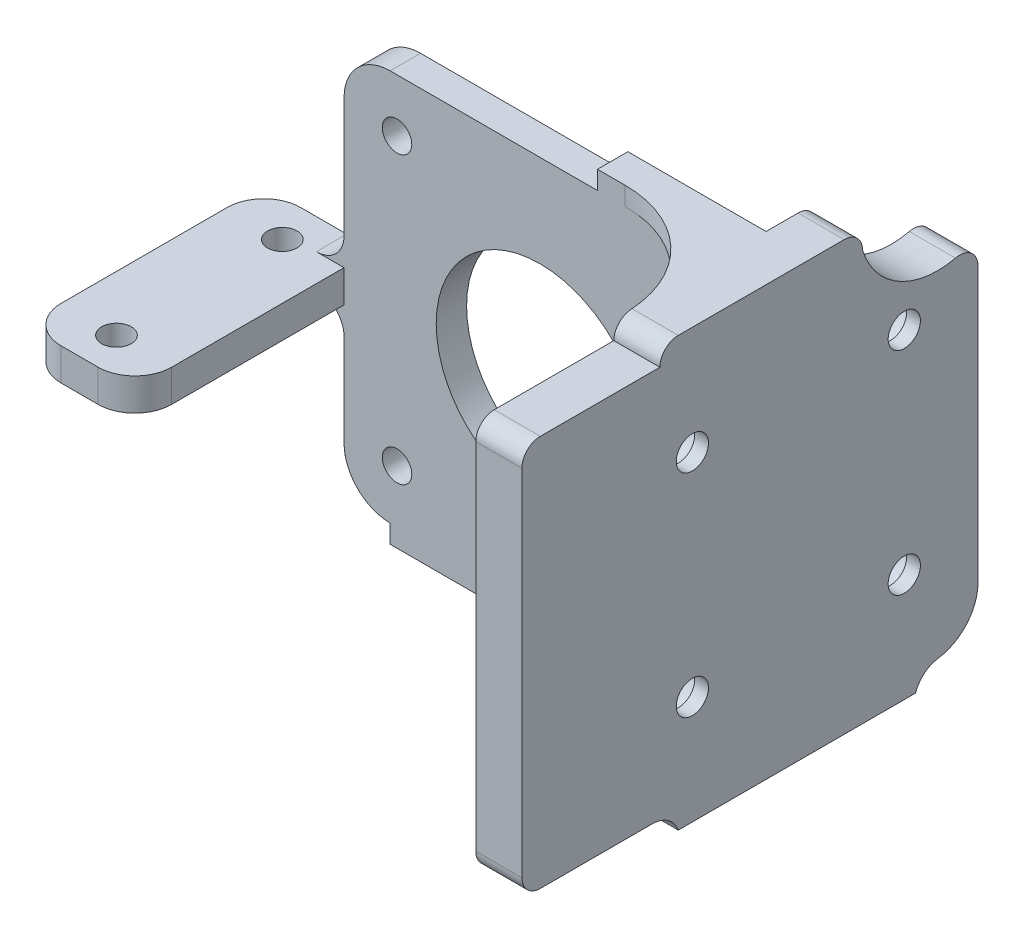
from build123d import *

# Parameters (mm, degrees)
CROQUIS1_W               = 42.5
CROQUIS1_H               = 42.5
SALIENTE_EXTRUIR1_DEPTH  = 5
CROQUIS6_W               = 5
CROQUIS6_H               = 42.5
SALIENTE_EXTRUIR2_DEPTH  = 4
CROQUIS7_W               = 4
CROQUIS7_H               = 42.5
SALIENTE_EXTRUIR3_DEPTH  = 42.5
CROQUIS8_R               = 11.25
CROQUIS8_R_2             = 1.6
CORTAR_EXTRUIR2_DEPTH    = 4
CROQUIS10_W              = 4
CROQUIS10_H              = 3.5
SALIENTE_EXTRUIR4_DEPTH  = 12
CROQUIS11_W              = 12
CROQUIS11_H              = 3.5
SALIENTE_EXTRUIR5_DEPTH  = 22
CROQUIS12_R              = 1.6
CORTAR_EXTRUIR4_DEPTH    = 3.5
REDONDEO1_R              = 5
REDONDEO2_R              = 5
REDONDEO3_R              = 4
CORTAR_EXTRUIR5_DEPTH    = 0.7
CROQUIS14_W              = 5
CROQUIS14_H              = 42.5
SALIENTE_EXTRUIR6_DEPTH  = 18
CROQUIS15_R              = 1.75
CORTAR_EXTRUIR6_DEPTH    = 5
CROQUIS16_R              = 2.8
CORTAR_EXTRUIR7_DEPTH    = 3.5
CROQUIS17_R              = 2.8
CORTAR_EXTRUIR8_DEPTH    = 3.5
REDONDEO5_R              = 5
CROQUIS18_R              = 1.6
SALIENTE_EXTRUIR8_DEPTH  = 2
CROQUIS19_R              = 1.6
CORTAR_EXTRUIR9_DEPTH    = 2
REDONDEO7_R              = 3
REDONDEO8_R              = 3
SALIENTE_EXTRUIR9_DEPTH  = 2
SALIENTE_EXTRUIR10_DEPTH = 2
CROQUIS22_W              = 26.97020456
CROQUIS22_H              = 2
CORTAR_EXTRUIR10_DEPTH   = 5
CROQUIS23_W              = 1.770204561
CROQUIS23_H              = 2
CORTAR_EXTRUIR11_DEPTH   = 5
REDONDEO9_R              = 3
CORTAR_EXTRUIR12_START   = -5
CORTAR_EXTRUIR12_DEPTH   = 5
REDONDEO10_R             = 2
SALIENTE_EXTRUIR11_DEPTH = 2
REDONDEO11_R             = 2


# Some blends are built 0.0001 mm under size
with BuildPart() as part:
    # Croquis1 → Saliente-Extruir1 (new body)
    with BuildSketch(Plane(origin=(0, 0, 0), x_dir=(0, 0, -1), z_dir=(1, 0, 0))):
        with Locations((-2.329734219, -7.130398671)):
            Rectangle(CROQUIS1_W, CROQUIS1_H)
    extrude(amount=-SALIENTE_EXTRUIR1_DEPTH)

    # Croquis6 → Saliente-Extruir2 (add)
    with BuildSketch(Plane(origin=(0, 0, -18.920265781), x_dir=(-1, 0, 0), z_dir=(0, 0, -1))):
        with Locations((2.5, -7.130398671)):
            Rectangle(CROQUIS6_W, CROQUIS6_H)
    extrude(amount=SALIENTE_EXTRUIR2_DEPTH)

    # Croquis7 → Saliente-Extruir3 (add)
    with BuildSketch(Plane.ZY.offset(5)):
        with Locations((-20.920265781, -7.130398671)):
            Rectangle(CROQUIS7_W, CROQUIS7_H)
    extrude(amount=SALIENTE_EXTRUIR3_DEPTH)

    # Croquis8 → Cortar-Extruir2 (cut)
    with BuildSketch(Plane.XY.offset(-18.920265781)):
        with Locations((-26.25, -7.130398671)):
            Circle(CROQUIS8_R)
        with Locations((-41.75, 8.369601329)):
            Circle(CROQUIS8_R_2)
        with Locations((-10.75, 8.369601329)):
            Circle(CROQUIS8_R_2)
        with Locations((-10.75, -22.630398671)):
            Circle(CROQUIS8_R_2)
        with Locations((-41.75, -22.630398671)):
            Circle(CROQUIS8_R_2)
    extrude(amount=-CORTAR_EXTRUIR2_DEPTH, mode=Mode.SUBTRACT)

    # Croquis10 → Saliente-Extruir4 (add)
    with BuildSketch(Plane.ZY.offset(47.5)):
        with Locations((-20.920265781, -6.630398671)):
            Rectangle(CROQUIS10_W, CROQUIS10_H)
    extrude(amount=SALIENTE_EXTRUIR4_DEPTH)

    # Croquis11 → Saliente-Extruir5 (add)
    with BuildSketch(Plane.XY.offset(-18.920265781)):
        with Locations((-53.5, -6.630398671)):
            Rectangle(CROQUIS11_W, CROQUIS11_H)
    extrude(amount=SALIENTE_EXTRUIR5_DEPTH)

    # Croquis12 → Cortar-Extruir4 (cut)
    with BuildSketch(Plane(origin=(0, -4.880398671, 0), x_dir=(1, 0, 0), z_dir=(0, 1, 0))):
        with Locations(Location((-53.5, 18.920265781, 0), (0, 0, 270))):
            Circle(CROQUIS12_R)
        with Locations(Location((-53.5, 0.920265781, 0), (0, 0, 270))):
            Circle(CROQUIS12_R)
    extrude(amount=-CORTAR_EXTRUIR4_DEPTH, mode=Mode.SUBTRACT)

    # Redondeo1
    redondeo1_edges = [part.edges().sort_by_distance(p)[0] for p in [
        (-2.5, -28.380398671, 23.579734219),
        (-2.5, 14.119601329, 23.579734219),
    ]]
    fillet(redondeo1_edges, radius=REDONDEO1_R)

    # Redondeo2
    redondeo2_edges = [part.edges().sort_by_distance(p)[0] for p in [
        (-47.5, -28.380398671, -20.920265781),
        (-47.5, 14.119601329, -20.920265781),
    ]]
    fillet(redondeo2_edges, radius=REDONDEO2_R)

    # Redondeo3
    redondeo3_edges = [part.edges().sort_by_distance(p)[0] for p in [
        (-59.5, -6.630398671, -22.920265781),
        (-59.5, -6.630398671, 3.079734219),
        (-47.5, -6.630398671, 3.079734219),
    ]]
    fillet(redondeo3_edges, radius=REDONDEO3_R)

    # Croquis13 → Cortar-Extruir5 (cut)
    with BuildSketch(Plane.XY.offset(-18.920265781)):
        with BuildLine():
            Line((-47.5, -8.380398671), (-47.5, -23.380398671))
            ThreePointArc((-47.5, -23.380398671), (-46.035533906, -26.915932577), (-42.5, -28.380398671))
            Line((-42.5, -28.380398671), (-5, -28.380398671))
            Line((-5, -28.380398671), (-5, 14.119601329))
            Line((-5, 14.119601329), (-42.5, 14.119601329))
            ThreePointArc((-42.5, 14.119601329), (-46.035533906, 12.655135235), (-47.5, 9.119601329))
            Line((-47.5, 9.119601329), (-47.5, -4.880398671))
            Line((-47.5, -4.880398671), (-47.5, -8.380398671))
        make_face()
    extrude(amount=-CORTAR_EXTRUIR5_DEPTH, mode=Mode.SUBTRACT)

    # Croquis14 → Saliente-Extruir6 (add)
    with BuildSketch(Plane(origin=(0, 0, -22.920265781), x_dir=(-1, 0, 0), z_dir=(0, 0, -1))):
        with Locations((2.5, -7.130398671)):
            Rectangle(CROQUIS14_W, CROQUIS14_H)
    extrude(amount=SALIENTE_EXTRUIR6_DEPTH)

    # Croquis15 → Cortar-Extruir6 (cut)
    with BuildSketch(Plane(origin=(0, 0, 0), x_dir=(0, 0, -1), z_dir=(1, 0, 0))):
        with Locations((9.920265781, 4.369601329)):
            Circle(CROQUIS15_R)
        with Locations((32.920265781, 4.369601329)):
            Circle(CROQUIS15_R)
        with Locations((32.920265781, -18.630398671)):
            Circle(CROQUIS15_R)
        with Locations((9.920265781, -18.630398671)):
            Circle(CROQUIS15_R)
    extrude(amount=-CORTAR_EXTRUIR6_DEPTH, mode=Mode.SUBTRACT)

    # Croquis16 → Cortar-Extruir7 (cut)
    with BuildSketch(Plane.ZY.offset(5)):
        with Locations((-9.920265781, 4.369601329)):
            Circle(CROQUIS16_R)
        with Locations((-9.920265781, -18.630398671)):
            Circle(CROQUIS16_R)
    extrude(amount=-CORTAR_EXTRUIR7_DEPTH, mode=Mode.SUBTRACT)

    # Croquis17 → Cortar-Extruir8 (cut)
    with BuildSketch(Plane.ZY.offset(5)):
        with Locations(Location((-32.920265781, 4.369601329, 0), (0, 0, 270))):
            Circle(CROQUIS17_R)
        with Locations(Location((-32.920265781, -18.630398671, 0), (0, 0, 270))):
            Circle(CROQUIS17_R)
    extrude(amount=-CORTAR_EXTRUIR8_DEPTH, mode=Mode.SUBTRACT)

    # Redondeo5
    redondeo5_edges = [part.edges().sort_by_distance(p)[0] for p in [
        (-2.5, -28.380398671, -40.920265781),
        (-2.5, 14.119601329, -40.920265781),
    ]]
    fillet(redondeo5_edges, radius=REDONDEO5_R)

    # Croquis18 → Saliente-Extruir8 (add)
    with BuildSketch(Plane.XZ.offset(8.380398671)):
        with BuildLine():
            Line((-59.5, -0.920265781), (-59.5, -18.920265781))
            ThreePointArc((-59.5, -18.920265781), (-58.328427125, -21.748692905), (-55.5, -22.920265781))
            Line((-55.5, -22.920265781), (-47.5, -22.920265781))
            Line((-47.5, -22.920265781), (-47.5, -19.620265781))
            Line((-47.5, -19.620265781), (-47.5, -0.920265781))
            ThreePointArc((-47.5, -0.920265781), (-48.671572875, 1.908161344), (-51.5, 3.079734219))
            Line((-51.5, 3.079734219), (-55.5, 3.079734219))
            ThreePointArc((-55.5, 3.079734219), (-58.328427125, 1.908161344), (-59.5, -0.920265781))
        make_face()
        with Locations(Location((-53.5, -0.920265781, 0), (0, 0, 90))):
            Circle(CROQUIS18_R, mode=Mode.SUBTRACT)
        with Locations(Location((-53.5, -18.920265781, 0), (0, 0, 90))):
            Circle(CROQUIS18_R, mode=Mode.SUBTRACT)
    extrude(amount=SALIENTE_EXTRUIR8_DEPTH)

    # Croquis19 → Cortar-Extruir9 (cut)
    with BuildSketch(Plane(origin=(0, -4.880398671, 0), x_dir=(1, 0, 0), z_dir=(0, 1, 0))):
        with BuildLine():
            Line((-51.5, -3.079734219), (-55.5, -3.079734219))
            ThreePointArc((-55.5, -3.079734219), (-58.328427125, -1.908161344), (-59.5, 0.920265781))
            Line((-59.5, 0.920265781), (-59.5, 18.920265781))
            ThreePointArc((-59.5, 18.920265781), (-58.328427125, 21.748692905), (-55.5, 22.920265781))
            Line((-55.5, 22.920265781), (-47.5, 22.920265781))
            Line((-47.5, 22.920265781), (-47.5, 19.620265781))
            Line((-47.5, 19.620265781), (-47.5, 0.920265781))
            ThreePointArc((-47.5, 0.920265781), (-48.671572875, -1.908161344), (-51.5, -3.079734219))
        make_face()
        with Locations(Location((-53.5, 18.920265781, 0), (0, 0, 270))):
            Circle(CROQUIS19_R, mode=Mode.SUBTRACT)
        with Locations(Location((-53.5, 0.920265781, 0), (0, 0, 270))):
            Circle(CROQUIS19_R, mode=Mode.SUBTRACT)
    extrude(amount=-CORTAR_EXTRUIR9_DEPTH, mode=Mode.SUBTRACT)

    # Redondeo7
    redondeo7_edges = [part.edges().sort_by_distance(p)[0] for p in [
        (-47.5, -6.880398671, -21.270265781),
    ]]
    fillet(redondeo7_edges, radius=REDONDEO7_R)

    # Redondeo8
    redondeo8_edges = [part.edges().sort_by_distance(p)[0] for p in [
        (-47.5, -10.380398671, -21.270265781),
    ]]
    fillet(redondeo8_edges, radius=REDONDEO8_R)

    # Croquis20 → Saliente-Extruir9 (add)
    with BuildSketch(Plane.XZ.offset(28.380398671)):
        Polygon((-5, -22.920265781), (-5, -35.920265781), (0, -35.920265781), (0, 18.579734219), (-5, 18.579734219), (-5, -19.620265781), (-42.5, -19.620265781), (-42.5, -22.920265781), align=None)
    extrude(amount=SALIENTE_EXTRUIR9_DEPTH)

    # Croquis21 → Saliente-Extruir10 (add)
    with BuildSketch(Plane.XZ.offset(30.380398671)):
        with BuildLine():
            Line((-16.22979544, -19.620265781), (-5, -19.620265781))
            Line((-5, -19.620265781), (-5, -8.390470341))
            ThreePointArc((-5, -8.390470341), (-8.771291942, -15.848973839), (-16.22979544, -19.620265781))
        make_face()
        with BuildLine():
            ThreePointArc((-16.22979544, -22.920265781), (-8.525539397, -26.445805177), (-5, -34.15006122))
            Line((-5, -34.15006122), (-5, -22.920265781))
            Line((-5, -22.920265781), (-16.22979544, -22.920265781))
        make_face()
    extrude(amount=-SALIENTE_EXTRUIR10_DEPTH)

    # Croquis22 → Cortar-Extruir10 (cut)
    with BuildSketch(Plane.ZY.offset(5)):
        with Locations((5.094631939, -29.380398671)):
            Rectangle(CROQUIS22_W, CROQUIS22_H)
    extrude(amount=-CORTAR_EXTRUIR10_DEPTH, mode=Mode.SUBTRACT)

    # Croquis23 → Cortar-Extruir11 (cut)
    with BuildSketch(Plane.ZY.offset(5)):
        with Locations((-35.035163501, -29.380398671)):
            Rectangle(CROQUIS23_W, CROQUIS23_H)
    extrude(amount=-CORTAR_EXTRUIR11_DEPTH, mode=Mode.SUBTRACT)

    # Redondeo9
    # the kernel refuses this fillet: 3 mm, written as the material it adds along each edge
    with BuildSketch(Plane(origin=(-5, -28.380398671, -34.15006122), x_dir=(0, -1, 0), z_dir=(1, 0, 0))) as redondeo9_piece_1:
        with BuildLine():
            CenterArc((2.926328174, 2.853404303), REDONDEO9_R, 187.781748717, 64.232765745)
            Line((-0.046044891, 2.447204399), (-0.343282198, 2.406584409))
            ThreePointArc((-0.343282198, 2.406584409), (-0.3, 1.77020456), (-0.3, 0))
            Line((-0.3, 0), (0, -0.3))
            ThreePointArc((0, -0.3), (1, -0.3), (1.907367183, -0.28534043))
            Line((1.907367183, -0.28534043), (2, 0))
        make_face()
    extrude(amount=5)
    with BuildSketch(Plane(origin=(-5, -28.380398671, -8.390470341), x_dir=(0, -1, 0), z_dir=(1, 0, 0))) as redondeo9_piece_2:
        with BuildLine():
            CenterArc((3, -2.828427125), REDONDEO9_R, 109.471220634, 70.528779366)
            Line((0, -2.828427125), (0, 0))
            Line((0, 0), (2, 0))
        make_face()
    extrude(amount=5)

    # Croquis24 → Cortar-Extruir12 (cut)
    with BuildSketch(Plane(origin=(0, 0, 0), x_dir=(0, 0, -1), z_dir=(1, 0, 0)).offset(CORTAR_EXTRUIR12_START)):
        with BuildLine():
            Line((-18.579734219, -28.380398671), (-8.579734219, -28.380398671))
            Line((-8.579734219, -28.380398671), (-8.579734219, 14.119601329))
            Line((-8.579734219, 14.119601329), (-18.579734219, 14.119601329))
            ThreePointArc((-18.579734219, 14.119601329), (-22.115268125, 12.655135235), (-23.579734219, 9.119601329))
            Line((-23.579734219, 9.119601329), (-23.579734219, -23.380398671))
            ThreePointArc((-23.579734219, -23.380398671), (-22.115268125, -26.915932577), (-18.579734219, -28.380398671))
        make_face()
        with BuildLine():
            Line((35.920265781, 14.119601329), (28.396227376, 14.119601329))
            ThreePointArc((28.396227376, 14.119601329), (33.490730397, 8.677818446), (40.915227569, 9.344004386))
            ThreePointArc((40.915227569, 9.344004386), (39.375550481, 12.73360294), (35.920265781, 14.119601329))
        make_face()
    extrude(amount=CORTAR_EXTRUIR12_DEPTH, mode=Mode.SUBTRACT)

    # Redondeo10
    redondeo10_edges = [part.edges().sort_by_distance(p)[0] for p in [
        (-2.5, 9.344004386, -40.915227569),
        (-2.5, -28.380398671, 8.579734219),
        (-2.5, 14.119601329, 8.579734219),
    ]]
    fillet(redondeo10_edges, radius=REDONDEO10_R)

    # Croquis25 → Saliente-Extruir11 (add)
    with BuildSketch(Plane(origin=(0, 14.119601329, 0), x_dir=(1, 0, 0), z_dir=(0, 1, 0))):
        with BuildLine():
            Line((-20, 22.920265781), (-20, 19.620265781))
            Line((-20, 19.620265781), (-17, 19.620265781))
            ThreePointArc((-17, 19.620265781), (-8.514718626, 16.105547155), (-5, 7.620265781))
            Line((-5, 7.620265781), (-5, 6.396227376))
            Line((-5, 6.396227376), (0, 6.396227376))
            Line((0, 6.396227376), (0, 28.396227376))
            Line((0, 28.396227376), (-5, 28.396227376))
            Line((-5, 28.396227376), (-5, 22.920265781))
            Line((-5, 22.920265781), (-20, 22.920265781))
        make_face()
    extrude(amount=SALIENTE_EXTRUIR11_DEPTH)

    # Redondeo11
    redondeo11_edges = [part.edges().sort_by_distance(p)[0] for p in [
        (-2.5, 16.119601329, -28.396227376),
        (-2.5, 16.119601329, -6.396227376),
    ]]
    fillet(redondeo11_edges, radius=REDONDEO11_R - 0.0001)  # a hair under: the kernel refuses the full size


solid = part.part
